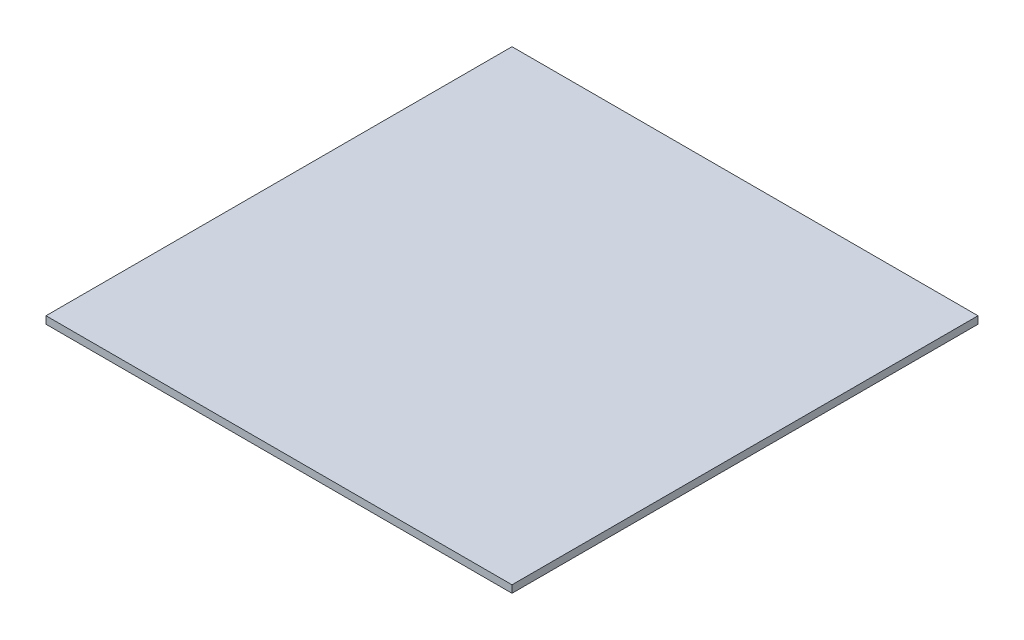
from build123d import *

# Parameters (mm, degrees)
SKETCH1_W           = 400
SKETCH1_H           = 400
BOSS_EXTRUDE1_DEPTH = 6.35


with BuildPart() as part:
    # Sketch1 → Boss-Extrude1 (new body)
    with BuildSketch(Plane(origin=(0, 0, 0), x_dir=(1, 0, 0), z_dir=(0, 1, 0))):
        with Locations((200, 200)):
            Rectangle(SKETCH1_W, SKETCH1_H)
    extrude(amount=BOSS_EXTRUDE1_DEPTH)


solid = part.part
